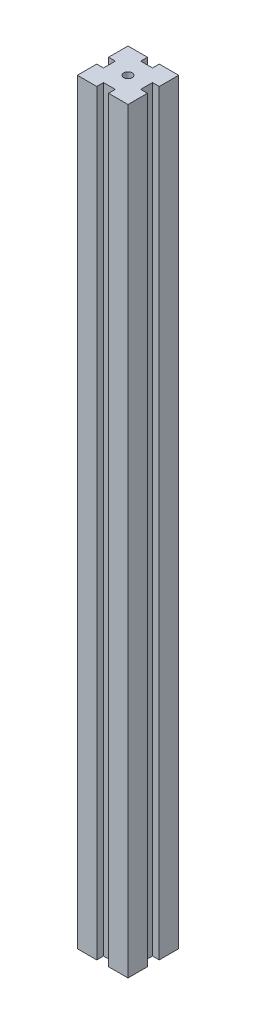
from build123d import *

# Parameters (mm, degrees)
BOSS_EXTRUDE1_DEPTH = 224
SKETCH2_R           = 1.25
CUT_EXTRUDE1_DEPTH  = 226.002222211


with BuildPart() as part:
    # Sketch1 → Boss-Extrude1 (new body)
    with BuildSketch(Plane(origin=(0, 0, 0), x_dir=(1, 0, 0), z_dir=(0, 1, 0))):
        Polygon((0, 5.75), (0, 0), (5.75, 0), (5.75, 2), (9.25, 2), (9.25, 0), (15, 0), (15, 5.75), (13, 5.75), (13, 9.25), (15, 9.25), (15, 15), (9.25, 15), (9.25, 13), (5.75, 13), (5.75, 15), (0, 15), (0, 9.25), (2, 9.25), (2, 5.75), align=None)
    extrude(amount=BOSS_EXTRUDE1_DEPTH)

    # Sketch2 → Cut-Extrude1 (cut, through all)
    with BuildSketch(Plane(origin=(0, 224, 0), x_dir=(1, 0, 0), z_dir=(0, 1, 0))):
        with Locations((7.5, 7.5)):
            Circle(SKETCH2_R)
    extrude(amount=-CUT_EXTRUDE1_DEPTH, mode=Mode.SUBTRACT)


solid = part.part
